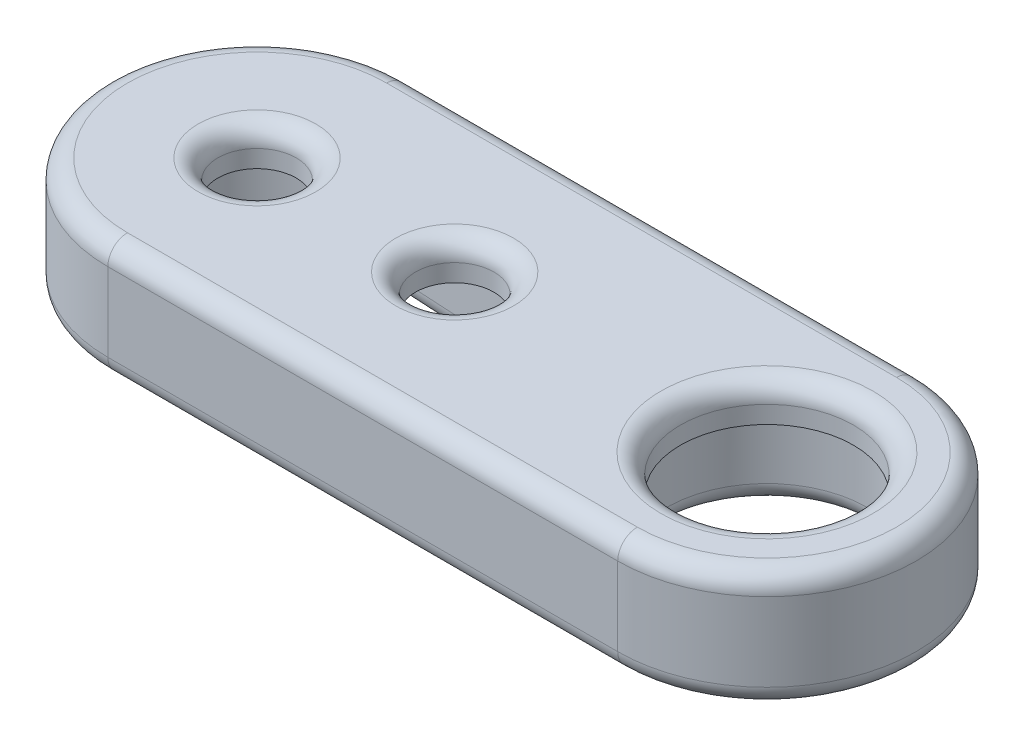
from build123d import *

# Parameters (mm, degrees)
SKETCH1_R           = 4.064
BOSS_EXTRUDE1_DEPTH = 4.5
SKETCH2_R           = 1.5875
SKETCH2_R_2         = 3.5
BOSS_EXTRUDE2_DEPTH = 1.5
CUT_EXTRUDE1_DEPTH  = 1.2375
FILLET2_R           = 0.79375
FILLET3_R           = 0.79375


with BuildPart() as part:
    # Sketch1 → Boss-Extrude1 (new body)
    with BuildSketch(Plane(origin=(0, 0, 0), x_dir=(1, 0, 0), z_dir=(0, 1, 0))):
        with BuildLine():
            Line((0, 6.04), (20.6375, 6.04))
            ThreePointArc((20.6375, 6.04), (26.6775, 0), (20.6375, -6.04))
            Line((20.6375, -6.04), (0, -6.04))
            ThreePointArc((0, -6.04), (-6.04, 0), (0, 6.04))
        make_face()
        with Locations(Location((20.6375, 0, 0), (0, 0, 270))):
            Circle(SKETCH1_R, mode=Mode.SUBTRACT)
        with BuildLine():
            Line((2.286372673, 2.65), (14.110293316, 1.99695653))
            ThreePointArc((14.110293316, 1.99695653), (16, 0), (14.110293316, -1.99695653))
            Line((14.110293316, -1.99695653), (2.286372673, -2.65))
            ThreePointArc((2.286372673, -2.65), (-3.5, 0), (2.286372673, 2.65))
        make_face(mode=Mode.SUBTRACT)
    extrude(amount=BOSS_EXTRUDE1_DEPTH)

    # Sketch2 → Boss-Extrude2 (add)
    with BuildSketch(Plane(origin=(0, 4.5, 0), x_dir=(1, 0, 0), z_dir=(0, 1, 0))):
        with BuildLine():
            Line((20.6375, 6.04), (0, 6.04))
            ThreePointArc((0, 6.04), (-6.04, 0), (0, -6.04))
            Line((0, -6.04), (20.6375, -6.04))
            ThreePointArc((20.6375, -6.04), (26.6775, 0), (20.6375, 6.04))
        make_face()
        with Locations(Location((0, 0, 0), (0, 0, 90))):
            Circle(SKETCH2_R, mode=Mode.SUBTRACT)
        with Locations(Location((8, 0, 0), (0, 0, 90))):
            Circle(SKETCH2_R, mode=Mode.SUBTRACT)
        with Locations(Location((20.6375, 0, 0), (0, 0, 90))):
            Circle(SKETCH2_R_2, mode=Mode.SUBTRACT)
    extrude(amount=BOSS_EXTRUDE2_DEPTH)

    # Sketch3 → Cut-Extrude1 (cut)
    with BuildSketch(Plane.XZ):
        with BuildLine():
            Line((20.6375, 6.04), (0, 6.04))
            ThreePointArc((0, 6.04), (-6.04, 0), (0, -6.04))
            Line((0, -6.04), (20.6375, -6.04))
            ThreePointArc((20.6375, -6.04), (26.6775, 0), (20.6375, 6.04))
        make_face()
    extrude(amount=-CUT_EXTRUDE1_DEPTH, mode=Mode.SUBTRACT)

    # Fillet2
    # the kernel refuses this fillet: 0.79375 mm, written as the material it takes off along each edge
    with BuildSketch(Plane(origin=(0.305017366, 1.2375, 2.75943165), x_dir=(0.055146658226504934, 0, 0.9984782652048311), z_dir=(0.9984782652048312, 0, -0.055146658226504934)), Plane(origin=(14.110293316, 1.2375, -1.99695653), x_dir=(0.055146658226504934, 0, -0.9984782652048311), z_dir=(-0.9984782652048312, 0, -0.055146658226504934))) as fillet2_piece_1:
        with BuildLine():
            CenterArc((FILLET2_R, -FILLET2_R), FILLET2_R, 90, 90)
            Line((0, -FILLET2_R), (0, 0))
            Line((0, 0), (FILLET2_R, 0))
        make_face()
    extrude(amount=13.826315937, mode=Mode.SUBTRACT)
    with BuildSketch(Plane(origin=(0, 1.2375, 0), x_dir=(0.958233566749164, 0, 0.28598676814701657), z_dir=(0.28598676814701657, 0, -0.958233566749164))) as fillet2_piece_2:
        with BuildLine():
            CenterArc((3.5 + FILLET2_R, -FILLET2_R), FILLET2_R, 90, 90)
            Line((3.5, -FILLET2_R), (3.5, 0))
            Line((3.5, 0), (3.5 + FILLET2_R, 0))
        make_face()
    revolve(axis=Axis((0, 1.2375, 0), (0, -1, 0)), revolution_arc=326.764317032, mode=Mode.SUBTRACT)
    with BuildSketch(Plane(origin=(14, 1.2375, 0), x_dir=(0.055146658226505, 0, -0.9984782652048312), z_dir=(-0.9984782652048312, 0, -0.055146658226505))) as fillet2_piece_3:
        with BuildLine():
            CenterArc((2 + FILLET2_R, -FILLET2_R), FILLET2_R, 90, 90)
            Line((2, -FILLET2_R), (2, 0))
            Line((2, 0), (2 + FILLET2_R, 0))
        make_face()
    revolve(axis=Axis((14, 1.2375, 0), (0, -1, 0)), revolution_arc=173.677451052, mode=Mode.SUBTRACT)
    with BuildSketch(Plane(origin=(20.6375, 1.2375, 0), x_dir=(0, 0, 1), z_dir=(1, 0, 0))) as fillet2_piece_4:
        with BuildLine():
            CenterArc((4.064 + FILLET2_R, -FILLET2_R), FILLET2_R, 90, 90)
            Line((4.064, -FILLET2_R), (4.064, 0))
            Line((4.064, 0), (4.064 + FILLET2_R, 0))
        make_face()
    revolve(axis=Axis((20.6375, 1.2375, 0), (0, -1, 0)), mode=Mode.SUBTRACT)
    with BuildSketch(Plane(origin=(20.6375, 1.2375, 0), x_dir=(0, 0, -1), z_dir=(-1, 0, 0))) as fillet2_piece_5:
        with BuildLine():
            CenterArc((6.04 - FILLET2_R, -FILLET2_R), FILLET2_R, 0, 90)
            Line((6.04, -FILLET2_R), (6.04, 0))
            Line((6.04, 0), (6.04 - FILLET2_R, 0))
        make_face()
    revolve(axis=Axis((20.6375, 1.2375, 0), (0, -1, 0)), revolution_arc=180, mode=Mode.SUBTRACT)
    with BuildSketch(Plane(origin=(0, 1.2375, -6.04), x_dir=(0, 0, 1), z_dir=(1, 0, 0)), Plane(origin=(20.6375, 1.2375, 6.04), x_dir=(0, 0, -1), z_dir=(-1, 0, 0))) as fillet2_piece_6:
        with BuildLine():
            CenterArc((FILLET2_R, -FILLET2_R), FILLET2_R, 90, 90)
            Line((0, -FILLET2_R), (0, 0))
            Line((0, 0), (FILLET2_R, 0))
        make_face()
    extrude(amount=20.6375, mode=Mode.SUBTRACT)
    with BuildSketch(Plane(origin=(0, 1.2375, 0), x_dir=(0, 0, 1), z_dir=(1, 0, 0))) as fillet2_piece_7:
        with BuildLine():
            CenterArc((6.04 - FILLET2_R, -FILLET2_R), FILLET2_R, 0, 90)
            Line((6.04 - FILLET2_R, 0), (6.04, 0))
            Line((6.04, 0), (6.04, -FILLET2_R))
        make_face()
    revolve(axis=Axis((0, 1.2375, 0), (0, -1, 0)), revolution_arc=180, mode=Mode.SUBTRACT)

    # Fillet3
    fillet3_edges = [part.edges().sort_by_distance(p)[0] for p in [
        (26.6775, 6, 0),
        (10.31875, 6, -6.04),
        (-6.04, 6, 0),
        (10.31875, 6, 6.04),
        (8, 6, 1.5875),
        (20.6375, 6, 3.5),
        (0, 6, 1.5875),
    ]]
    fillet(fillet3_edges, radius=FILLET3_R)


solid = part.part
